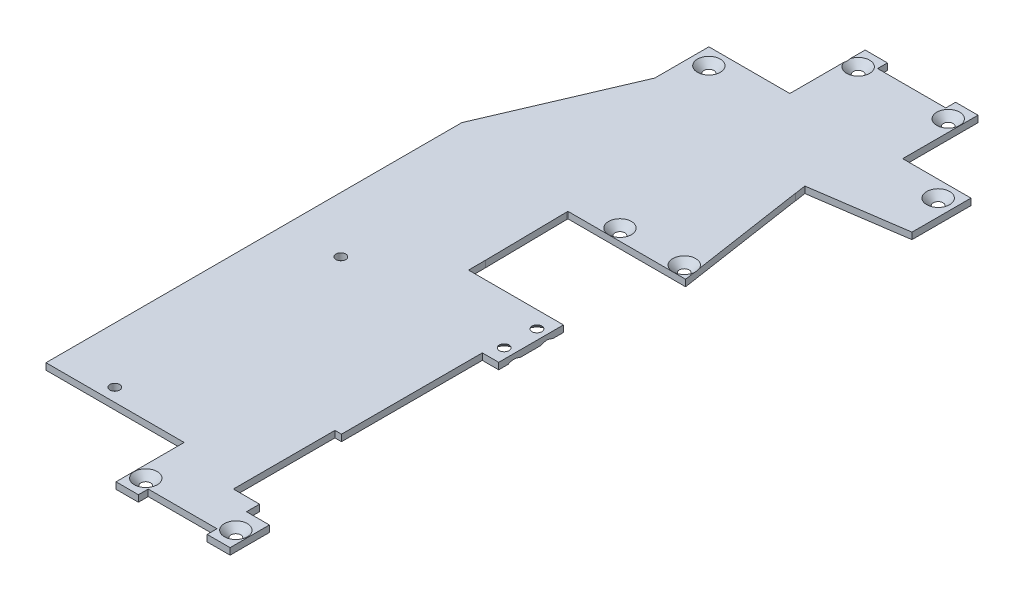
from build123d import *

# Parameters (mm, degrees)
SKETCH1_R           = 1.5
BOSS_EXTRUDE1_DEPTH = 2
CHAMFER1_SIZE       = 2
SKETCH4_W           = 36.30312698
SKETCH4_H           = 0.486110151
CUT_EXTRUDE3_DEPTH  = 10
SKETCH5_W           = 29
SKETCH5_H           = 1.352839956
CUT_EXTRUDE4_DEPTH  = 10
SKETCH6_R           = 1.5
CUT_EXTRUDE5_DEPTH  = 2
SKETCH2_W           = 29
SKETCH2_H           = 5.227477133
CUT_EXTRUDE1_DEPTH  = 10
SKETCH7_R           = 1.5
CUT_EXTRUDE6_DEPTH  = 2
CHAMFER2_SIZE       = 2
CUT_EXTRUDE7_DEPTH  = 10
SKETCH9_W           = 2.845003066
SKETCH9_H           = 3
CUT_EXTRUDE8_DEPTH  = 2
SKETCH10_W          = 2.678834089
SKETCH10_H          = 3.000004318
BOSS_EXTRUDE2_DEPTH = 2
SKETCH11_W          = 3.5
SKETCH11_H          = 3
CUT_EXTRUDE9_DEPTH  = 2
SKETCH12_W          = 3.3
SKETCH12_H          = 23.000004318
BOSS_EXTRUDE3_DEPTH = 2
SKETCH13_W          = 2.845003066
SKETCH13_H          = 20
CUT_EXTRUDE10_DEPTH = 2
SKETCH14_R          = 1.5
CUT_EXTRUDE11_DEPTH = 2
CHAMFER3_SIZE       = 2
SKETCH15_W          = 0.991837727
SKETCH15_H          = 3
CUT_EXTRUDE12_DEPTH = 2
SKETCH16_W          = 0.826217407
SKETCH16_H          = 20.799074454
BOSS_EXTRUDE4_DEPTH = 2
SKETCH17_R          = 1.5
CUT_EXTRUDE13_DEPTH = 2
CHAMFER4_SIZE       = 2


# Some blends are built 0.0001 mm under size
with BuildPart() as part:
    # Sketch1 → Boss-Extrude1 (new body)
    with BuildSketch(Plane(origin=(0, 0, 0), x_dir=(1, 0, 0), z_dir=(0, 1, 0))):
        Polygon((0, 4.604246944), (7, 4.604246944), (7, 1.604246944), (27, 1.604246944), (27, 4.604246944), (34, 4.604246944), (34, -18.395753056), (52, -18.395753056), (52, -36.395753056), (23.933920219, -43.895753056), (29.976717731, -83.895753056), (-6.023282269, -83.895753056), (-5.667548556, -108.895753056), (23.332451444, -108.895753056), (23.332451444, -133.895753056), (18.332451444, -133.895753056), (18.332451444, -176.895753056), (16.332451444, -176.895753056), (16.332451444, -207.895753056), (24.332451444, -207.895753056), (24.332451444, -211.895753056), (31.332451444, -211.895753056), (31.332451444, -223.895753056), (24.332451444, -223.895753056), (24.332451444, -220.895753056), (4.332451444, -220.895753056), (4.332451444, -223.895753056), (-2.667548556, -223.895753056), (-2.667548556, -203.096678602), (-45.667548556, -203.096678602), (-45.667548556, -76.129309552), (-28, -34.929185263), (-28, -18.395753056), (0, -18.395753056), align=None)
        with Locations(Location((47, -23.395753056, 0), (0, 0, 270))):
            Circle(SKETCH1_R, mode=Mode.SUBTRACT)
        with Locations(Location((-23, -23.395753056, 0), (0, 0, 270))):
            Circle(SKETCH1_R, mode=Mode.SUBTRACT)
        with Locations(Location((25.976717731, -79.895753056, 0), (0, 0, 270))):
            Circle(SKETCH1_R, mode=Mode.SUBTRACT)
        with Locations(Location((6.356717731, -79.895753056, 0), (0, 0, 270))):
            Circle(SKETCH1_R, mode=Mode.SUBTRACT)
    extrude(amount=BOSS_EXTRUDE1_DEPTH)

    # Chamfer1
    # the kernel refuses this chamfer: 2 mm, written as the material it takes off along each edge
    with BuildSketch(Plane(origin=(6.356717731, 2, 79.895753056), x_dir=(0, 0, 1), z_dir=(-1, 0, 0))) as chamfer1_piece_1:
        Polygon((1.5, -CHAMFER1_SIZE), (1.5 + CHAMFER1_SIZE, 0), (1.5, 0), align=None)
    revolve(axis=Axis((6.356717731, 2, 79.895753056), (0, 1, 0)), mode=Mode.SUBTRACT)
    with BuildSketch(Plane(origin=(25.976717731, 2, 79.895753056), x_dir=(0, 0, 1), z_dir=(-1, 0, 0))) as chamfer1_piece_2:
        Polygon((1.5, -CHAMFER1_SIZE), (1.5 + CHAMFER1_SIZE, 0), (1.5, 0), align=None)
    revolve(axis=Axis((25.976717731, 2, 79.895753056), (0, 1, 0)), mode=Mode.SUBTRACT)
    with BuildSketch(Plane(origin=(-23, 2, 23.395753056), x_dir=(0, 0, 1), z_dir=(-1, 0, 0))) as chamfer1_piece_3:
        Polygon((1.5, -CHAMFER1_SIZE), (1.5 + CHAMFER1_SIZE, 0), (1.5, 0), align=None)
    revolve(axis=Axis((-23, 2, 23.395753056), (0, 1, 0)), mode=Mode.SUBTRACT)
    with BuildSketch(Plane(origin=(47, 2, 23.395753056), x_dir=(0, 0, 1), z_dir=(-1, 0, 0))) as chamfer1_piece_4:
        Polygon((1.5, -CHAMFER1_SIZE), (1.5 + CHAMFER1_SIZE, 0), (1.5, 0), align=None)
    revolve(axis=Axis((47, 2, 23.395753056), (0, 1, 0)), mode=Mode.SUBTRACT)

    # Sketch4 → Cut-Extrude3 (cut)
    with BuildSketch(Plane(origin=(0, 2, 0), x_dir=(1, 0, 0), z_dir=(0, 1, 0))):
        with Locations((12.128281221, -83.65269798)):
            Rectangle(SKETCH4_W, SKETCH4_H)
    extrude(amount=-CUT_EXTRUDE3_DEPTH, mode=Mode.SUBTRACT)

    # Sketch5 → Cut-Extrude4 (cut)
    with BuildSketch(Plane(origin=(0, 2, 0), x_dir=(1, 0, 0), z_dir=(0, 1, 0))):
        with Locations((8.832451444, -109.572173034)):
            Rectangle(SKETCH5_W, SKETCH5_H)
    extrude(amount=-CUT_EXTRUDE4_DEPTH, mode=Mode.SUBTRACT)

    # Sketch6 → Cut-Extrude5 (cut)
    with BuildSketch(Plane(origin=(0, 2, 0), x_dir=(1, 0, 0), z_dir=(0, 1, 0))):
        with Locations(Location((-28.667548556, -130.096678602, 0), (0, 0, 270))):
            Circle(SKETCH6_R)
        with Locations(Location((-28.667548556, -199.096678602, 0), (0, 0, 270))):
            Circle(SKETCH6_R)
    extrude(amount=-CUT_EXTRUDE5_DEPTH, mode=Mode.SUBTRACT)

    # Sketch2 → Cut-Extrude1 (cut)
    with BuildSketch(Plane(origin=(0, 2, 0), x_dir=(1, 0, 0), z_dir=(0, 1, 0))):
        with Locations((8.832451444, -111.509491623)):
            Rectangle(SKETCH2_W, SKETCH2_H)
    extrude(amount=-CUT_EXTRUDE1_DEPTH, mode=Mode.SUBTRACT)

    # Sketch7 → Cut-Extrude6 (cut)
    with BuildSketch(Plane(origin=(0, 2, 0), x_dir=(1, 0, 0), z_dir=(0, 1, 0))):
        with Locations(Location((20.332451444, -119.213897383, 0), (0, 0, 270))):
            Circle(SKETCH7_R)
        with Locations(Location((20.332451444, -129.213897383, 0), (0, 0, 270))):
            Circle(SKETCH7_R)
    extrude(amount=-CUT_EXTRUDE6_DEPTH, mode=Mode.SUBTRACT)

    # Chamfer2
    # the kernel refuses this chamfer: 2 mm, written as the material it takes off along each edge
    with BuildSketch(Plane(origin=(20.332451444, 0, 119.213897383), x_dir=(0, 0, 1), z_dir=(-1, 0, 0))) as chamfer2_piece_1:
        Polygon((1.5 + CHAMFER2_SIZE, 0), (1.5, CHAMFER2_SIZE), (1.5, 0), align=None)
    revolve(axis=Axis((20.332451444, 0, 119.213897383), (0, 1, 0)), mode=Mode.SUBTRACT)
    with BuildSketch(Plane(origin=(20.332451444, 0, 129.213897383), x_dir=(0, 0, 1), z_dir=(-1, 0, 0))) as chamfer2_piece_2:
        Polygon((1.5 + CHAMFER2_SIZE, 0), (1.5, CHAMFER2_SIZE), (1.5, 0), align=None)
    revolve(axis=Axis((20.332451444, 0, 129.213897383), (0, 1, 0)), mode=Mode.SUBTRACT)

    # Sketch8 → Cut-Extrude7 (cut)
    with BuildSketch(Plane(origin=(0, 2, 0), x_dir=(1, 0, 0), z_dir=(0, 1, 0))):
        Polygon((23.96091905, -43.888538253), (52, -36.395753056), (23.459204593, -40.551765872), align=None)
    extrude(amount=-CUT_EXTRUDE7_DEPTH, mode=Mode.SUBTRACT)

    # Sketch9 → Cut-Extrude8 (cut)
    with BuildSketch(Plane(origin=(0, 2, 0), x_dir=(1, 0, 0), z_dir=(0, 1, 0))):
        with Locations((32.577498467, 3.104246944)):
            Rectangle(SKETCH9_W, SKETCH9_H)
    extrude(amount=-CUT_EXTRUDE8_DEPTH, mode=Mode.SUBTRACT)

    # Sketch10 → Boss-Extrude2 (add)
    with BuildSketch(Plane(origin=(0, 2, 0), x_dir=(1, 0, 0), z_dir=(0, 1, 0))):
        with Locations((25.660582956, 3.104249103)):
            Rectangle(SKETCH10_W, SKETCH10_H)
    extrude(amount=-BOSS_EXTRUDE2_DEPTH)

    # Sketch11 → Cut-Extrude9 (cut)
    with BuildSketch(Plane(origin=(0, 2, 0), x_dir=(1, 0, 0), z_dir=(0, 1, 0))):
        with Locations((5.25, 3.104246944)):
            Rectangle(SKETCH11_W, SKETCH11_H)
    extrude(amount=-CUT_EXTRUDE9_DEPTH, mode=Mode.SUBTRACT)

    # Sketch12 → Boss-Extrude3 (add)
    with BuildSketch(Plane(origin=(0, 2, 0), x_dir=(1, 0, 0), z_dir=(0, 1, 0))):
        with Locations((-1.65, -6.895750897)):
            Rectangle(SKETCH12_W, SKETCH12_H)
    extrude(amount=-BOSS_EXTRUDE3_DEPTH)

    # Sketch13 → Cut-Extrude10 (cut)
    with BuildSketch(Plane(origin=(0, 2, 0), x_dir=(1, 0, 0), z_dir=(0, 1, 0))):
        with Locations((32.577498467, -8.395753056)):
            Rectangle(SKETCH13_W, SKETCH13_H)
    extrude(amount=-CUT_EXTRUDE10_DEPTH, mode=Mode.SUBTRACT)

    # Sketch14 → Cut-Extrude11 (cut)
    with BuildSketch(Plane.XZ):
        with Locations(Location((0.071165911, 0.895748738, 0), (0, 0, 270))):
            Circle(SKETCH14_R)
        with Locations(Location((27.571165911, 0.895748738, 0), (0, 0, 270))):
            Circle(SKETCH14_R)
    extrude(amount=-CUT_EXTRUDE11_DEPTH, mode=Mode.SUBTRACT)

    # Chamfer3
    # the kernel refuses this chamfer: 2 mm, written as the material it takes off along each edge
    with BuildSketch(Plane(origin=(0.071165911, 2, 0.895748738), x_dir=(0, 0, -1), z_dir=(-1, 0, 0))) as chamfer3_piece_1:
        Polygon((1.5 + CHAMFER3_SIZE, 0), (1.5, CHAMFER3_SIZE), (1.5, 0), align=None)
    revolve(axis=Axis((0.071165911, 2, 0.895748738), (0, -1, 0)), mode=Mode.SUBTRACT)
    with BuildSketch(Plane(origin=(27.571165911, 2, 0.895748738), x_dir=(0, 0, -1), z_dir=(-1, 0, 0))) as chamfer3_piece_2:
        Polygon((1.5 + CHAMFER3_SIZE, 0), (1.5, CHAMFER3_SIZE), (1.5, 0), align=None)
    revolve(axis=Axis((27.571165911, 2, 0.895748738), (0, -1, 0)), mode=Mode.SUBTRACT)

    # Sketch15 → Cut-Extrude12 (cut)
    with BuildSketch(Plane(origin=(0, 2, 0), x_dir=(1, 0, 0), z_dir=(0, 1, 0))):
        with Locations((3.836532581, -222.395753056)):
            Rectangle(SKETCH15_W, SKETCH15_H)
    extrude(amount=-CUT_EXTRUDE12_DEPTH, mode=Mode.SUBTRACT)

    # Sketch16 → Boss-Extrude4 (add)
    with BuildSketch(Plane(origin=(0, 2, 0), x_dir=(1, 0, 0), z_dir=(0, 1, 0))):
        with Locations((-3.08065726, -213.496215829)):
            Rectangle(SKETCH16_W, SKETCH16_H)
    extrude(amount=-BOSS_EXTRUDE4_DEPTH)

    # Sketch17 → Cut-Extrude13 (cut)
    with BuildSketch(Plane.XZ):
        with Locations(Location((27.590613723, 218.395405635, 0), (0, 0, 270))):
            Circle(SKETCH17_R)
        with Locations(Location((0.090613723, 218.395405628, 0), (0, 0, 270))):
            Circle(SKETCH17_R)
    extrude(amount=-CUT_EXTRUDE13_DEPTH, mode=Mode.SUBTRACT)

    # Chamfer4
    chamfer4_edges = [part.edges().sort_by_distance(p)[0] for p in [
        (27.590613723, 2, 219.895405635),
        (0.090613723, 2, 219.895405628),
    ]]
    chamfer(chamfer4_edges, length=CHAMFER4_SIZE - 0.0001)  # a hair under: the kernel refuses the full size


solid = part.part
